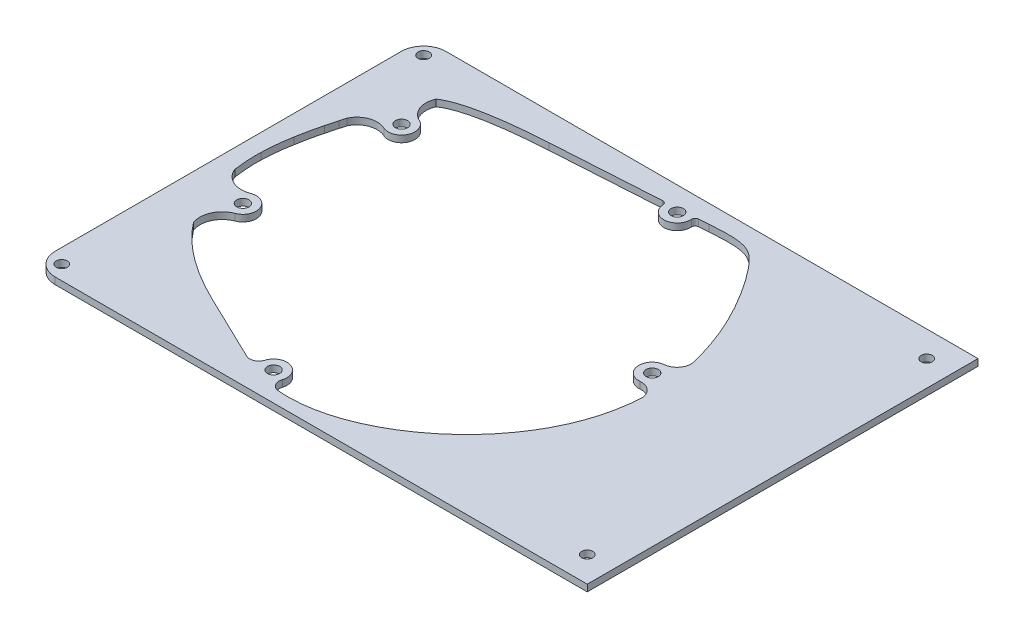
from build123d import *

# Parameters (mm, degrees)
ESQUISSE1_R         = 2.5
BOSS_EXTRU_1_DEPTH  = 3
CUT_EXTRUDE1_START  = -3
CUT_EXTRUDE1_DEPTH  = 3
BOSS_EXTRUDE1_DEPTH = 3
SKETCH1_R           = 2.75
CUT_EXTRUDE2_DEPTH  = 3


# Read off the part's stored shape, not the designer's step: Cut-Extrude1
with BuildPart() as part:
    # Esquisse1 → Boss.-Extru.1 (new body)
    with BuildSketch(Plane(origin=(0, 0, 0), x_dir=(1, 0, 0), z_dir=(0, 1, 0))):
        with BuildLine():
            Line((-85, 119.989574584), (153.28624341, 119.989574584))
            Line((153.28624341, 119.989574584), (153.28624341, -55.010425416))
            Line((153.28624341, -55.010425416), (-85, -55.010425416))
            ThreePointArc((-85, -55.010425416), (-92.071067812, -52.081493228), (-95, -45.010425416))
            Line((-95, -45.010425416), (-95, 109.989574584))
            ThreePointArc((-95, 109.989574584), (-92.071067812, 117.060642396), (-85, 119.989574584))
        make_face()
        with Locations(Location((141.78624341, -43.510425416, 0), (0, 0, 270))):
            Circle(ESQUISSE1_R, mode=Mode.SUBTRACT)
        with Locations(Location((141.78624341, 108.489574584, 0), (0, 0, 270))):
            Circle(ESQUISSE1_R, mode=Mode.SUBTRACT)
        with Locations(Location((-88.535533906, 113.52510849, 0), (0, 0, 270))):
            Circle(ESQUISSE1_R, mode=Mode.SUBTRACT)
        with Locations(Location((-88.535533906, -48.545959322, 0), (0, 0, 270))):
            Circle(ESQUISSE1_R, mode=Mode.SUBTRACT)
    extrude(amount=BOSS_EXTRU_1_DEPTH)

    # Cut-Extrude1 outline → Cut-Extrude1 (cut)
    with BuildSketch(Plane.XZ.offset(CUT_EXTRUDE1_START)):
        with BuildLine():
            Line((-26.534089411, -107.649444077), (41.026883272, -111.837107673))
            add(Edge.make_bspline(
                [(41.026883272, -111.837107673), (80.871896507, -115.445570806), (43.6868837, -98.824618367), (93.841601725, -105.501811245), (103.459361301, -42.407292201), (100.29035903, -19.379375914), (109.081082927, -3.387830236), (48.623008548, 72.204101039), (-7.977504863, 44.465677035)],
                knots=[0, 0, 0, 0, 0, 0, 0, 0, 0, 1, 1, 1, 1, 1, 1, 1, 1, 1], degree=8))
            Line((-7.977504863, 44.465677035), (-40.958080323, 28.587571847))
            add(Edge.make_bspline(
                [(-40.958080323, 28.587571847), (-63.284478038, 17.843514847), (-77.245184412, 4.644427122), (-85.775449686, -19.222136636), (-87.563403654, -31.078889142), (-86.988969289, -45.934210012), (-86.496578535, -48.869280426), (-84.771877477, -58.734159705), (-84.595340706, -59.308431064), (-82.980639435, -65.721995035), (-82.521559893, -67.446566753), (-82.039157422, -69.164892884)],
                knots=[0, 0, 0, 0, 1, 1, 1.52461883, 1.52461883, 1.947694096, 1.947694096, 2.583008028, 2.583008028, 2.817830116, 2.817830116, 2.817830116, 2.817830116], degree=3))
            add(Edge.make_bspline(
                [(-82.039157422, -69.164892884), (-78.230073131, -83.238962063), (-67.06916766, -105.136939227), (-26.534089411, -107.649444077)],
                knots=[0, 0, 0, 1, 1.688392895, 1.688392895, 1.688392895], degree=2))
        make_face()
    extrude(amount=CUT_EXTRUDE1_DEPTH, mode=Mode.SUBTRACT)

    # Sketch4 → Boss-Extrude1 (add)
    with BuildSketch(Plane(origin=(0, 0, 0), x_dir=(1, 0, 0), z_dir=(0, 1, 0))):
        with BuildLine():
            Line((93.302020541, 29.767829549), (97.480208944, 29.767829549))
            Line((97.480208944, 29.767829549), (95.391114743, 55.173684352))
            Line((95.391114743, 55.173684352), (91.102425061, 54.233284915))
            ThreePointArc((91.102425061, 54.233284915), (89.667608862, 49.644276713), (85.408121779, 47.41392616))
            ThreePointArc((85.408121779, 47.41392616), (79.969495118, 40.900759492), (86.482661786, 35.462132831))
            ThreePointArc((86.482661786, 35.462132831), (91.071669987, 34.027316631), (93.302020541, 29.767829549))
        make_face()
        with BuildLine():
            Line((36.624084675, 111.564206934), (36.331188094, 116.289605103))
            Line((36.331188094, 116.289605103), (21.485435183, 115.369413807))
            Line((21.485435183, 115.369413807), (21.384316793, 110.619593222))
            ThreePointArc((21.384316793, 110.619593222), (22.567491202, 110.213275552), (23.116811871, 109.089334924))
            ThreePointArc((23.116811871, 109.089334924), (29.47650759, 103.472016137), (35.093826377, 109.831711857))
            ThreePointArc((35.093826377, 109.831711857), (35.500144047, 111.014886266), (36.624084675, 111.564206934))
        make_face()
        with BuildLine():
            Line((-68.679115078, 99.310003258), (-77.197650928, 103.460523399))
            Line((-77.197650928, 103.460523399), (-90.092844695, 74.888102234))
            Line((-90.092844695, 74.888102234), (-81.269930428, 71.936494141))
            ThreePointArc((-81.269930428, 71.936494141), (-76.179120901, 76.650519158), (-69.246055906, 76.384092275))
            ThreePointArc((-69.246055906, 76.384092275), (-61.287768194, 79.327841024), (-64.231516944, 87.286128736))
            ThreePointArc((-64.231516944, 87.286128736), (-68.94554196, 92.376938263), (-68.679115078, 99.310003258))
        make_face()
        with BuildLine():
            Line((-86.523393512, 26.954917178), (-90.889130919, 29.767829549))
            Line((-90.889130919, 29.767829549), (-75.16950367, -12.427072891))
            Line((-75.16950367, -12.427072891), (-75.16950367, -2.91348489))
            ThreePointArc((-75.16950367, -2.91348489), (-74.944749705, 4.719117072), (-69.388760046, 9.957256624))
            ThreePointArc((-69.388760046, 9.957256624), (-65.912247557, 17.697661065), (-73.652651998, 21.174173554))
            ThreePointArc((-73.652651998, 21.174173554), (-81.28525396, 21.39892752), (-86.523393512, 26.954917178))
        make_face()
        with BuildLine():
            Line((8.366944085, -49.112206716), (11.747056213, -51.290065422))
            Line((11.747056213, -51.290065422), (-16.208470261, -45.189381197))
            Line((-16.208470261, -45.189381197), (-10.926193077, -43.04606622))
            ThreePointArc((-10.926193077, -43.04606622), (-7.791078178, -42.76925209), (-5.769954322, -40.356653937))
            ThreePointArc((-5.769954322, -40.356653937), (1.753445752, -36.432567887), (5.677531802, -43.955967961))
            ThreePointArc((5.677531802, -43.955967961), (5.954345932, -47.09108286), (8.366944085, -49.112206716))
        make_face()
    extrude(amount=BOSS_EXTRUDE1_DEPTH)

    # Sketch1 → Cut-Extrude2 (cut)
    with BuildSketch(Plane(origin=(0, 3, 0), x_dir=(1, 0, 0), z_dir=(0, 1, 0))):
        with Locations(Location((29.105319124, 109.46052339, 0), (0, 0, 270))):
            Circle(SKETCH1_R)
        with Locations(Location((85.945391782, 41.438029495, 0), (0, 0, 270))):
            Circle(SKETCH1_R)
        with Locations(Location((-0.04621126, -42.156310949, 0), (0, 0, 270))):
            Circle(SKETCH1_R)
        with Locations(Location((-66.738786425, 81.835110506, 0), (0, 0, 270))):
            Circle(SKETCH1_R)
        with Locations(Location((-71.520706022, 15.565715089, 0), (0, 0, 270))):
            Circle(SKETCH1_R)
    extrude(amount=-CUT_EXTRUDE2_DEPTH, mode=Mode.SUBTRACT)


solid = part.part
